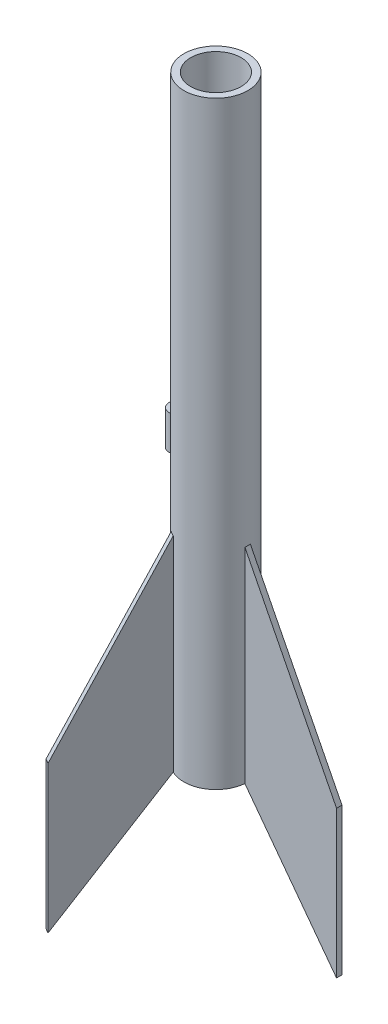
from build123d import *

# Parameters (mm, degrees)
SKETCH2_R                = 11.75
SKETCH2_R_2              = 9.25
BOSS_EXTRUDE1_DEPTH      = 220
SKETCH5_R                = 9.5
SKETCH5_R_2              = 4.625
BOSS_EXTRUDE2_DEPTH      = 12
BOSS_EXTRUDE3_DEPTH      = 1
CIRPATTERN1_COUNT        = 3
BOSS_EXTRUDE4_DEPTH      = 6.35
BOSS_EXTRUDE4_DEPTH_BACK = 6.35
SKETCH8_R                = 3.17
SKETCH8_R_2              = 1.9
SKETCH9_W                = 0.6
SKETCH9_H                = 16.330262046


with BuildPart() as part:
    # Sketch2 → Boss-Extrude1 (new body)
    with BuildSketch(Plane(origin=(-2.465768249, 0, -0.081027564), x_dir=(1, 0, 0), z_dir=(0, 1, 0))):
        with Locations((2.411661176, 0)):
            Circle(SKETCH2_R)
        with Locations((2.411661176, 0)):
            Circle(SKETCH2_R_2, mode=Mode.SUBTRACT)
    extrude(amount=BOSS_EXTRUDE1_DEPTH)

    # Sketch5 → Boss-Extrude2 (add)
    with BuildSketch(Plane(origin=(0, 60, 0), x_dir=(1, 0, 0), z_dir=(0, 1, 0))):
        with Locations((-0.054107074, 0.081027564)):
            Circle(SKETCH5_R)
        with Locations((-0.054107074, 0.081027564)):
            Circle(SKETCH5_R_2, mode=Mode.SUBTRACT)
    extrude(amount=BOSS_EXTRUDE2_DEPTH)

    # Sketch7 → Boss-Extrude3 (add, symmetric)
    with BuildSketch(Plane.XY):
        Polygon((11.695892926, 75.2), (9.828211369, 75.2), (10.695892926, 0), (11.695892926, 0), (45.34731611, -45), (45.34731611, 9), align=None)
    boss_extrude3 = extrude(amount=BOSS_EXTRUDE3_DEPTH, both=True)

    # CirPattern1: Boss-Extrude3 ×3 about axis
    cirpattern1_axis = Axis((-0.054107074, 220, -0.081027564), (0, -1, 0))
    for i in range(1, CIRPATTERN1_COUNT):
        add(boss_extrude3.rotate(cirpattern1_axis, i * 360 / CIRPATTERN1_COUNT))

    # Sketch8 → Boss-Extrude4 (add, two sides: drawn at the far end of the back side and taken through both)
    with BuildSketch(Plane(origin=(0.379836366, 100, 0), x_dir=(1, 0, 0), z_dir=(0, 1, 0)).offset(-BOSS_EXTRUDE4_DEPTH_BACK)):
        with Locations((-14.4, 0)):
            Circle(SKETCH8_R)
        with Locations((-14.4, 0)):
            Circle(SKETCH8_R_2, mode=Mode.SUBTRACT)
    extrude(amount=BOSS_EXTRUDE4_DEPTH + BOSS_EXTRUDE4_DEPTH_BACK)

    # Sketch9 → Revolve-Thin1 (revolve)
    with BuildSketch(Plane(origin=(0, 110, 0), x_dir=(1, 0, 0), z_dir=(0, 1, 0))):
        with Locations((-6.373250471, 0)):
            Rectangle(SKETCH9_W, SKETCH9_H)
    revolve(axis=Axis((-6.673250471, 110, -8.165131023), (0, 0, 1)))


solid = part.part
